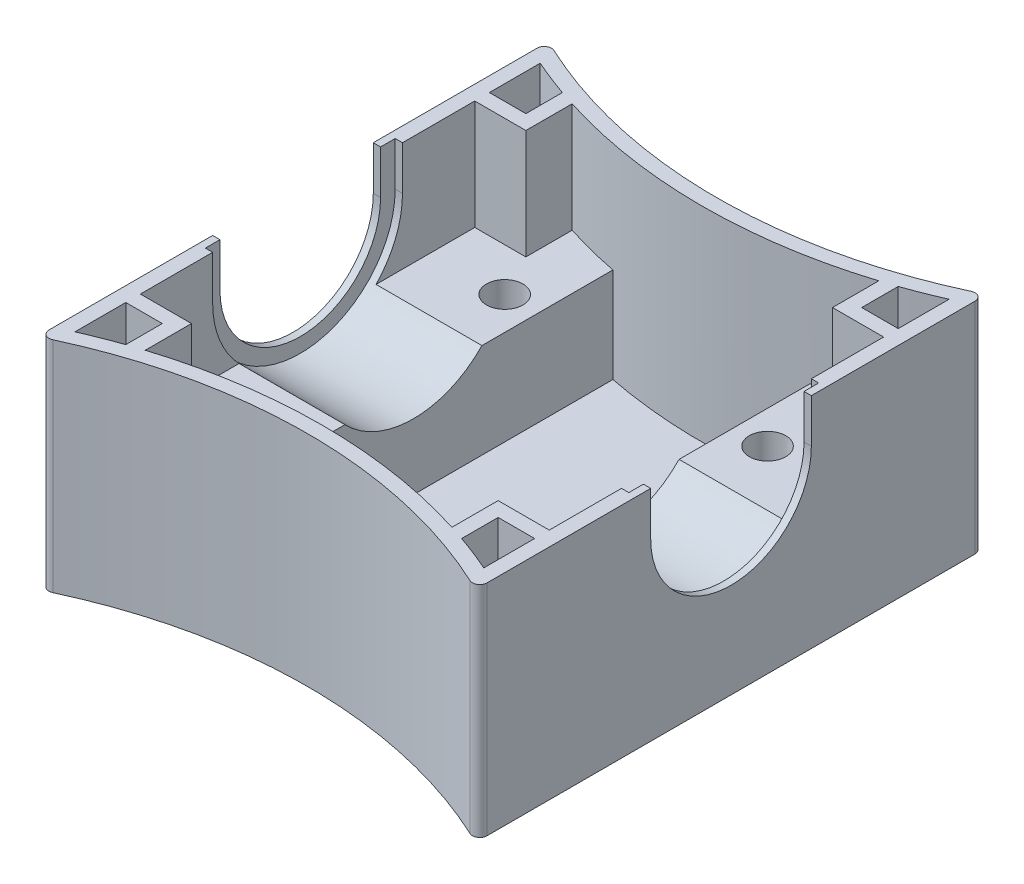
from build123d import *

# Parameters (mm, degrees)
RESSALTO_EXTRUS_O2_DEPTH = 30
CASCA1_T                 = -2
RESSALTO_EXTRUS_O3_DEPTH = 28
RESSALTO_EXTRUS_O4_DEPTH = 13
CASCA2_START             = 2
CASCA2_DEPTH             = 13
RESSALTO_EXTRUS_O5_DEPTH = 13
RESSALTO_EXTRUS_O6_DEPTH = 13
CORTE_EXTRUS_O1_DEPTH    = 60
RESSALTO_EXTRUS_O7_DEPTH = 1
RESSALTO_EXTRUS_O8_START = -1
RESSALTO_EXTRUS_O8_DEPTH = 1
ESBO_O16_R               = 11
CORTE_EXTRUS_O2_DEPTH    = 60
ESBO_O17_R               = 2.5
CORTE_EXTRUS_O3_DEPTH    = 15
FILETE1_R                = 1
ESBO_O18_W               = 1
ESBO_O18_H               = 2
RESSALTO_EXTRUS_O9_DEPTH = 6


# Read off the part's stored shape, not the designer's step: Casca2, Ressalto-extrusão5, Ressalto-extrusão6
with BuildPart() as part:
    # Esboço2 → Ressalto-extrusão2 (new body)
    with BuildSketch(Plane(origin=(0, 0, 0), x_dir=(1, 0, 0), z_dir=(0, 1, 0))):
        with BuildLine():
            Line((-30, 35), (-30, -35))
            ThreePointArc((-30, -35), (0, -28), (30, -35))
            Line((30, -35), (30, 35))
            ThreePointArc((30, 35), (0, 28), (-30, 35))
        make_face()
    extrude(amount=RESSALTO_EXTRUS_O2_DEPTH)

    # Casca1
    casca1_openings = [part.faces().sort_by_distance(p)[0] for p in [
        (0, 30, 0),
    ]]
    offset(amount=CASCA1_T, openings=casca1_openings, kind=Kind.INTERSECTION)

    # Esboço5 → Ressalto-extrusão3 (add)
    with BuildSketch(Plane(origin=(0, 2, 0), x_dir=(1, 0, 0), z_dir=(0, 1, 0))):
        with BuildLine():
            Line((28, 22.89910018), (28, 24.89910018))
            Line((28, 24.89910018), (23, 24.89910018))
            Line((23, 24.89910018), (23, 29.89910018))
            ThreePointArc((23, 29.89910018), (22.002508446, 29.559318185), (21, 29.234636771))
            Line((21, 29.234636771), (21, 22.89910018))
            Line((21, 22.89910018), (28, 22.89910018))
        make_face()
        with BuildLine():
            ThreePointArc((-23, -29.89910018), (-22.002508446, -29.559318185), (-21, -29.234636771))
            Line((-21, -29.234636771), (-21, -22.89910018))
            Line((-21, -22.89910018), (-28, -22.89910018))
            Line((-28, -22.89910018), (-28, -24.89910018))
            Line((-28, -24.89910018), (-23, -24.89910018))
            Line((-23, -24.89910018), (-23, -29.89910018))
        make_face()
        with BuildLine():
            Line((-21, 22.89910018), (-21, 29.234636771))
            ThreePointArc((-21, 29.234636771), (-22.002508446, 29.559318185), (-23, 29.89910018))
            Line((-23, 29.89910018), (-23, 24.89910018))
            Line((-23, 24.89910018), (-28, 24.89910018))
            Line((-28, 24.89910018), (-28, 22.89910018))
            Line((-28, 22.89910018), (-21, 22.89910018))
        make_face()
        with BuildLine():
            Line((28, -24.89910018), (28, -22.89910018))
            Line((28, -22.89910018), (21, -22.89910018))
            Line((21, -22.89910018), (21, -29.234636771))
            ThreePointArc((21, -29.234636771), (22.002508446, -29.559318185), (23, -29.89910018))
            Line((23, -29.89910018), (23, -24.89910018))
            Line((23, -24.89910018), (28, -24.89910018))
        make_face()
    extrude(amount=RESSALTO_EXTRUS_O3_DEPTH)

    # Esboço6 → Ressalto-extrusão4 (add)
    with BuildSketch(Plane(origin=(0, 2, 0), x_dir=(1, 0, 0), z_dir=(0, 1, 0))):
        with BuildLine():
            Line((-15.5, 27.743110585), (-15.5, -27.743110585))
            ThreePointArc((-15.5, -27.743110585), (0, -26), (15.5, -27.743110585))
            Line((15.5, -27.743110585), (15.5, 27.743110585))
            ThreePointArc((15.5, 27.743110585), (0, 26), (-15.5, 27.743110585))
        make_face()
    extrude(amount=RESSALTO_EXTRUS_O4_DEPTH)

    # Casca2 outline → Casca2 (cut)
    with BuildSketch(Plane(origin=(0, 0, 0), x_dir=(1, 0, 0), z_dir=(0, 1, 0)).offset(CASCA2_START)):
        with BuildLine():
            Line((-13.5, 27.318233549), (-13.5, -27.318233549))
            ThreePointArc((-13.5, -27.318233549), (0, -26), (13.5, -27.318233549))
            Line((13.5, -27.318233549), (13.5, 27.318233549))
            ThreePointArc((13.5, 27.318233549), (0, 26), (-13.5, 27.318233549))
        make_face()
    extrude(amount=CASCA2_DEPTH, mode=Mode.SUBTRACT)

    # Ressalto-extrusão5 outline → Ressalto-extrusão5 (add)
    with BuildSketch(Plane(origin=(0, 2, 0), x_dir=(1, 0, 0), z_dir=(0, 1, 0))):
        with BuildLine():
            Line((15.5, 27.743110585), (15.5, -27.743110585))
            ThreePointArc((15.5, -27.743110585), (18.265230976, -28.432709484), (21, -29.234636771))
            Line((21, -29.234636771), (21, -22.89910018))
            Line((21, -22.89910018), (28, -22.89910018))
            Line((28, -22.89910018), (28, 22.89910018))
            Line((28, 22.89910018), (21, 22.89910018))
            Line((21, 22.89910018), (21, 29.234636771))
            ThreePointArc((21, 29.234636771), (18.265230976, 28.432709484), (15.5, 27.743110585))
        make_face()
    extrude(amount=RESSALTO_EXTRUS_O5_DEPTH)

    # Ressalto-extrusão6 outline → Ressalto-extrusão6 (add)
    with BuildSketch(Plane(origin=(0, 2, 0), x_dir=(1, 0, 0), z_dir=(0, 1, 0))):
        with BuildLine():
            Line((-21, -22.89910018), (-21, -29.234636771))
            ThreePointArc((-21, -29.234636771), (-18.265230976, -28.432709484), (-15.5, -27.743110585))
            Line((-15.5, -27.743110585), (-15.5, 27.743110585))
            ThreePointArc((-15.5, 27.743110585), (-18.265230976, 28.432709484), (-21, 29.234636771))
            Line((-21, 29.234636771), (-21, 22.89910018))
            Line((-21, 22.89910018), (-28, 22.89910018))
            Line((-28, 22.89910018), (-28, -22.89910018))
            Line((-28, -22.89910018), (-21, -22.89910018))
        make_face()
    extrude(amount=RESSALTO_EXTRUS_O6_DEPTH)

    # Esboço9 → Corte-extrusão1 (cut)
    with BuildSketch(Plane.ZY.offset(30)):
        with BuildLine():
            ThreePointArc((-11.532562595, 30), (-12.62781283, 27.088420816), (-13, 24))
            ThreePointArc((-13, 24), (0, 11), (13, 24))
            ThreePointArc((13, 24), (12.62781283, 27.088420816), (11.532562595, 30))
            Line((11.532562595, 30), (-11.532562595, 30))
        make_face()
        with BuildLine():
            ThreePointArc((11.532562595, 30), (0, 37), (-11.532562595, 30))
            Line((-11.532562595, 30), (11.532562595, 30))
        make_face()
        with BuildLine():
            Line((-13, 44), (-13, 30))
            Line((-13, 30), (-11.532562595, 30))
            ThreePointArc((-11.532562595, 30), (0, 37), (11.532562595, 30))
            Line((11.532562595, 30), (13, 30))
            Line((13, 30), (13, 44))
            Line((13, 44), (-13, 44))
        make_face()
        with BuildLine():
            ThreePointArc((11.532562595, 30), (12.62781283, 27.088420816), (13, 24))
            Line((13, 24), (13, 30))
            Line((13, 30), (11.532562595, 30))
        make_face()
        with BuildLine():
            Line((-13, 30), (-13, 24))
            ThreePointArc((-13, 24), (-12.62781283, 27.088420816), (-11.532562595, 30))
            Line((-11.532562595, 30), (-13, 30))
        make_face()
    extrude(amount=-CORTE_EXTRUS_O1_DEPTH, mode=Mode.SUBTRACT)

    # Esboço14 → Ressalto-extrusão7 (add)
    with BuildSketch(Plane.ZY.offset(30)):
        with BuildLine():
            Line((-13, 24), (13, 24))
            ThreePointArc((13, 24), (0, 11), (-13, 24))
        make_face()
    extrude(amount=-RESSALTO_EXTRUS_O7_DEPTH)

    # Esboço15 → Ressalto-extrusão8 (add)
    with BuildSketch(Plane(origin=(30, 0, 0), x_dir=(0, 0, -1), z_dir=(1, 0, 0)).offset(RESSALTO_EXTRUS_O8_START)):
        with BuildLine():
            Line((-13, 24), (13, 24))
            ThreePointArc((13, 24), (0, 11), (-13, 24))
        make_face()
    extrude(amount=RESSALTO_EXTRUS_O8_DEPTH)

    # Esboço16 → Corte-extrusão2 (cut)
    with BuildSketch(Plane.ZY.offset(30)):
        with Locations((0, 24)):
            Circle(ESBO_O16_R)
    extrude(amount=-CORTE_EXTRUS_O2_DEPTH, mode=Mode.SUBTRACT)

    # Esboço17 → Corte-extrusão3 (cut)
    with BuildSketch(Plane(origin=(0, 15, 0), x_dir=(1, 0, 0), z_dir=(0, 1, 0))):
        with Locations(Location((18, 17, 0), (0, 0, 270))):
            Circle(ESBO_O17_R)
        with Locations(Location((-18, -17, 0), (0, 0, 270))):
            Circle(ESBO_O17_R)
        with Locations(Location((18, -17, 0), (0, 0, 270))):
            Circle(ESBO_O17_R)
        with Locations(Location((-18, 17, 0), (0, 0, 270))):
            Circle(ESBO_O17_R)
    extrude(amount=-CORTE_EXTRUS_O3_DEPTH, mode=Mode.SUBTRACT)

    # Filete1
    filete1_edges = [part.edges().sort_by_distance(p)[0] for p in [
        (-30, 15, 35),
        (-30, 15, -35),
        (30, 15, -35),
        (30, 15, 35),
    ]]
    fillet(filete1_edges, radius=FILETE1_R)

    # Esboço18 → Ressalto-extrusão9 (add)
    with BuildSketch(Plane(origin=(0, 24, 0), x_dir=(1, 0, 0), z_dir=(0, 1, 0))):
        with Locations((-29.5, 12)):
            Rectangle(ESBO_O18_W, ESBO_O18_H)
        with Locations((-29.5, -12)):
            Rectangle(ESBO_O18_W, ESBO_O18_H)
        with Locations((29.5, 12)):
            Rectangle(ESBO_O18_W, ESBO_O18_H)
        with Locations((29.5, -12)):
            Rectangle(ESBO_O18_W, ESBO_O18_H)
    extrude(amount=RESSALTO_EXTRUS_O9_DEPTH)


solid = part.part
